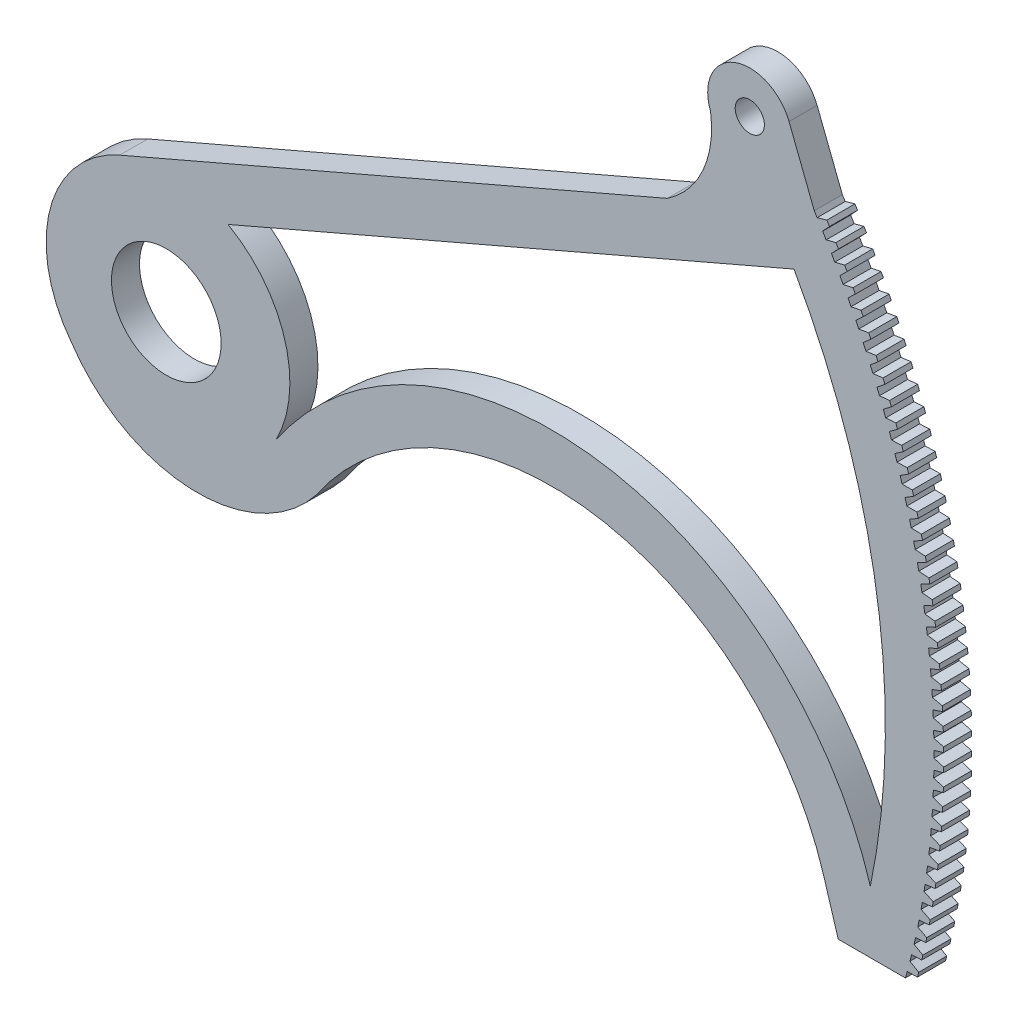
from build123d import *

# Parameters (mm, degrees)
SKETCH1_R           = 12.408212295
SKETCH1_R_2         = 3.302
BOSS_EXTRUDE1_DEPTH = 6.35


with BuildPart() as part:
    # Sketch1 → Boss-Extrude1 (new body)
    with BuildSketch(Plane(origin=(0, 0, 0), x_dir=(-1, 0, 0), z_dir=(0, 0, -1))):
        with BuildLine():
            Line((10.539485883, 25.458586117), (-113.354485872, 78.936296964))
            ThreePointArc((-113.354485872, 78.936296964), (-121.435921865, 88.480292523), (-123.16202884, 100.866495074))
            ThreePointArc((-123.16202884, 100.866495074), (-128.583573423, 113.191176173), (-140.91304048, 107.780524464))
            Line((-140.91304048, 107.780524464), (-146.633186787, 93.132961962))
            ThreePointArc((-146.633186787, 93.132961962), (-146.956062871, 92.622651964), (-147.27716299, 92.111222621))
            Line((-147.27716299, 92.111222621), (-149.484042103, 92.742363927))
            Line((-149.484042103, 92.742363927), (-150.076889657, 91.779911207))
            Line((-150.076889657, 91.779911207), (-148.521400775, 90.091251423))
            ThreePointArc((-148.521400775, 90.091251423), (-148.917928344, 89.434281397), (-149.311549889, 88.775566126))
            Line((-149.311549889, 88.775566126), (-151.53206555, 89.356913668))
            Line((-151.53206555, 89.356913668), (-152.10311697, 88.381370878))
            Line((-152.10311697, 88.381370878), (-150.510042508, 86.728122171))
            ThreePointArc((-150.510042508, 86.728122171), (-150.891694102, 86.062400165), (-151.270401156, 85.394998714))
            Line((-151.270401156, 85.394998714), (-153.503430022, 85.926258394))
            Line((-153.503430022, 85.926258394), (-154.052396417, 84.938119053))
            Line((-154.052396417, 84.938119053), (-152.422542301, 83.32111779))
            ThreePointArc((-152.422542301, 83.32111779), (-152.789124845, 82.646980588), (-153.152725822, 81.971230591))
            Line((-153.152725822, 81.971230591), (-155.39713822, 82.452133648))
            Line((-155.39713822, 82.452133648), (-155.923741872, 81.451897649))
            Line((-155.923741872, 81.451897649), (-154.257932633, 79.871961859))
            ThreePointArc((-154.257932633, 79.871961859), (-154.609260676, 79.189750502), (-154.957571632, 78.505993816))
            Line((-154.957571632, 78.505993816), (-157.212232131, 78.936296964))
            Line((-157.212232131, 78.936296964), (-157.716206636, 77.92447032))
            Line((-157.716206636, 77.92447032), (-156.015284993, 76.38239928))
            ThreePointArc((-156.015284993, 76.38239928), (-156.3511808, 75.692458895), (-156.68402553, 75.001041427))
            Line((-156.68402553, 75.001041427), (-158.947793513, 75.380526979))
            Line((-158.947793513, 75.380526979), (-159.428883912, 74.357621565))
            Line((-159.428883912, 74.357621565), (-157.69371035, 72.854195399))
            ThreePointArc((-157.69371035, 72.854195399), (-158.014003995, 72.156875021), (-158.331214113, 71.458146554))
            Line((-158.331214113, 71.458146554), (-160.602944356, 71.786622532))
            Line((-160.602944356, 71.786622532), (-161.06090727, 70.753155828))
            Line((-161.06090727, 70.753155828), (-159.292359601, 69.289135108))
            ThreePointArc((-159.292359601, 69.289135108), (-159.596889049, 68.584787506), (-159.898304081, 67.879101522))
            Line((-159.898304081, 67.879101522), (-162.176847332, 68.156401751))
            Line((-162.176847332, 68.156401751), (-162.611451081, 67.112896581))
            Line((-162.611451081, 67.112896581), (-160.810424001, 65.689021944))
            ThreePointArc((-160.810424001, 65.689021944), (-161.099035192, 64.978003443), (-161.384502654, 64.265716944))
            Line((-161.384502654, 64.265716944), (-163.668706215, 64.491701141))
            Line((-163.668706215, 64.491701141), (-164.079730936, 63.438685406))
            Line((-164.079730936, 63.438685406), (-162.247135571, 62.055677181))
            ThreePointArc((-162.247135571, 62.055677181), (-162.5196825, 61.338347479), (-162.789057976, 60.619820805))
            Line((-162.789057976, 60.619820805), (-165.077766285, 60.794374646))
            Line((-165.077766285, 60.794374646), (-165.465004044, 59.732381059))
            Line((-165.465004044, 59.732381059), (-163.60176749, 58.390938899))
            ThreePointArc((-163.60176749, 58.390938899), (-163.858112277, 57.667660889), (-164.111259493, 56.943257538))
            Line((-164.111259493, 56.943257538), (-166.403314708, 57.066292716))
            Line((-166.403314708, 57.066292716), (-166.766569603, 55.995858533))
            Line((-166.766569603, 55.995858533), (-164.873634459, 54.696661064))
            ThreePointArc((-164.873634459, 54.696661064), (-165.113647421, 53.967800647), (-165.350438311, 53.237887089))
            Line((-165.350438311, 53.237887089), (-167.644680899, 53.309341363))
            Line((-167.644680899, 53.309341363), (-167.983769163, 52.231008108))
            Line((-167.983769163, 52.231008108), (-166.06209305, 50.974712584))
            ThreePointArc((-166.06209305, 50.974712584), (-166.285652766, 50.240638486), (-166.50596754, 49.505583978))
            Line((-166.50596754, 49.505583978), (-168.801236859, 49.525421199))
            Line((-168.801236859, 49.525421199), (-169.11598695, 48.439734394))
            Line((-169.11598695, 48.439734394), (-167.166542031, 47.226976367))
            ThreePointArc((-167.166542031, 47.226976367), (-167.373535404, 46.488059949), (-167.577262605, 45.748236351))
            Line((-167.577262605, 45.748236351), (-169.872397496, 45.716446484))
            Line((-169.872397496, 45.716446484), (-170.162650183, 44.623955369))
            Line((-170.162650183, 44.623955369), (-168.186422668, 43.455348363))
            ThreePointArc((-168.186422668, 43.455348363), (-168.376744981, 42.711963439), (-168.563781546, 41.967745022))
            Line((-168.563781546, 41.967745022), (-170.857620917, 41.884344149))
            Line((-170.857620917, 41.884344149), (-171.123229364, 40.785601408))
            Line((-171.123229364, 40.785601408), (-169.121219012, 39.661736614))
            ThreePointArc((-169.121219012, 39.661736614), (-169.294773983, 38.914259256), (-169.46502529, 38.166022515))
            Line((-169.46502529, 38.166022515), (-171.756408704, 38.031052828))
            Line((-171.756408704, 38.031052828), (-171.997238542, 36.926614306))
            Line((-171.997238542, 36.926614306), (-169.970458155, 35.848060279))
            ThreePointArc((-169.970458155, 35.848060279), (-170.127157984, 35.096868631), (-170.280537906, 34.344992093))
            Line((-170.280537906, 34.344992093), (-172.568306168, 34.158521873))
            Line((-172.568306168, 34.158521873), (-172.784235562, 33.048946298))
            Line((-172.784235562, 33.048946298), (-170.733710474, 32.01624867))
            ThreePointArc((-170.733710474, 32.01624867), (-170.873475887, 31.261722754), (-171.009906829, 30.506586788))
            Line((-171.009906829, 30.506586788), (-173.292902575, 30.268710368))
            Line((-173.292902575, 30.268710368), (-173.483822288, 29.154559067))
            Line((-173.483822288, 29.154559067), (-171.410589846, 28.168240273))
            ThreePointArc((-171.410589846, 28.168240273), (-171.533350136, 27.410761798), (-171.652763079, 26.652748422))
            Line((-171.652763079, 26.652748422), (-173.929831357, 26.363586142))
            Line((-173.929831357, 26.363586142), (-174.095644805, 25.245422756))
            Line((-174.095644805, 25.245422756), (-172.00075384, 24.305981767))
            ThreePointArc((-172.00075384, 24.305981767), (-172.106446905, 23.545933936), (-172.208781439, 22.785426624))
            Line((-172.208781439, 22.785426624), (-174.478770297, 22.445124769))
            Line((-174.478770297, 22.445124769), (-174.619393595, 21.323514968))
            Line((-174.619393595, 21.323514968), (-172.503903899, 20.431427041))
            ThreePointArc((-172.503903899, 20.431427041), (-172.592476269, 19.669194357), (-172.677680624, 18.906577843))
            Line((-172.677680624, 18.906577843), (-174.93944169, 18.51530857))
            Line((-174.93944169, 18.51530857), (-175.054803699, 17.390819768))
            Line((-175.054803699, 17.390819768), (-172.919785481, 16.546536203))
            ThreePointArc((-172.919785481, 16.546536203), (-172.991192348, 15.782504275), (-173.059223419, 15.018164362))
            Line((-173.059223419, 15.018164362), (-175.311612486, 14.57612561))
            Line((-175.311612486, 14.57612561), (-175.401654844, 13.449326678))
            Line((-175.401654844, 13.449326678), (-173.248188196, 12.653274593))
            ThreePointArc((-173.248188196, 12.653274593), (-173.302393436, 11.887829937), (-173.353216807, 11.1221533))
            Line((-173.353216807, 11.1221533), (-175.595094406, 10.629568694))
            Line((-175.595094406, 10.629568694), (-175.659771562, 9.501029672))
            Line((-175.659771562, 9.501029672), (-173.488945907, 8.753611783))
            ThreePointArc((-173.488945907, 8.753611783), (-173.525922098, 7.987141633), (-173.559512057, 7.220515621))
            Line((-173.559512057, 7.220515621), (-175.78974404, 6.677634356))
            Line((-175.78974404, 6.677634356), (-175.829023274, 5.547926163))
            Line((-175.829023274, 5.547926163), (-173.641936816, 4.849520584))
            ThreePointArc((-173.641936816, 4.849520584), (-173.661665251, 4.082412692), (-173.678004807, 3.315225135))
            Line((-173.678004807, 3.315225135), (-175.895462915, 2.722321851))
            Line((-175.895462915, 2.722321851), (-175.909324356, 1.592015998))
            Line((-175.909324356, 1.592015998), (-173.707083527, 0.942976048))
            ThreePointArc((-173.707083527, 0.942976048), (-173.709554226, 0.175618488), (-173.708635111, -0.591742499))
            Line((-173.708635111, -0.591742499), (-175.912197548, -1.234367857))
            Line((-175.912197548, -1.234367857), (-175.900634184, -2.364699555))
            Line((-175.900634184, -2.364699555), (-173.684353082, -2.964045534))
            ThreePointArc((-173.684353082, -2.964045534), (-173.669564795, -3.731264561), (-173.651387474, -4.498410775))
            Line((-173.651387474, -4.498410775), (-175.839939474, -5.190433107))
            Line((-175.839939474, -5.190433107), (-175.802957154, -6.320218825))
            Line((-175.802957154, -6.320218825), (-173.573756979, -6.869567626))
            ThreePointArc((-173.573756979, -6.869567626), (-173.541717188, -7.636259989), (-173.506290858, -8.402803337))
            Line((-173.506290858, -8.402803337), (-175.678725248, -9.143872555))
            Line((-175.678725248, -9.143872555), (-175.616342682, -10.272540741))
            Line((-175.616342682, -10.272540741), (-173.37535117, -10.771614453))
            ThreePointArc((-173.37535117, -10.771614453), (-173.326076083, -11.537392289), (-173.273418666, -12.302944982))
            Line((-173.273418666, -12.302944982), (-175.428636427, -13.092686184))
            Line((-175.428636427, -13.092686184), (-175.340885173, -14.219665854))
            Line((-175.340885173, -14.219665854), (-173.089236026, -14.668211999))
            ThreePointArc((-173.089236026, -14.668211999), (-173.022750571, -15.432687906), (-172.952888705, -16.196862656))
            Line((-172.952888705, -16.196862656), (-175.089799529, -17.034876317))
            Line((-175.089799529, -17.034876317), (-174.97672398, -18.15959734))
            Line((-174.97672398, -18.15959734), (-172.71555629, -18.557389002))
            ThreePointArc((-172.71555629, -18.557389002), (-172.631894102, -19.320176238), (-172.54486313, -20.082586455))
            Line((-172.54486313, -20.082586455), (-174.662385969, -20.96844863))
            Line((-174.662385969, -20.96844863), (-174.524043328, -22.090342018))
            Line((-174.524043328, -22.090342018), (-172.254501005, -22.437177957))
            ThreePointArc((-172.254501005, -22.437177957), (-172.153704408, -23.197890633), (-172.049548358, -23.958150618))
            Line((-172.049548358, -23.958150618), (-174.146611972, -24.891413157))
            Line((-174.146611972, -24.891413157), (-173.983072227, -26.009911351))
            Line((-173.983072227, -26.009911351), (-171.706303415, -26.305616106))
            ThreePointArc((-171.706303415, -26.305616106), (-171.588423401, -27.063869382), (-171.467194965, -27.821594527))
            Line((-171.467194965, -27.821594527), (-173.542738465, -28.801785297))
            Line((-173.542738465, -28.801785297), (-173.35408435, -29.916322459))
            Line((-173.35408435, -29.916322459), (-171.07124085, -30.160746434))
            ThreePointArc((-171.07124085, -30.160746434), (-170.936337053, -30.916156716), (-170.79809756, -31.670963692))
            Line((-170.79809756, -31.670963692), (-172.851070943, -32.697586824))
            Line((-172.851070943, -32.697586824), (-172.637397896, -33.807599116))
            Line((-172.637397896, -33.807599116), (-170.349634582, -34.000618659))
            ThreePointArc((-170.349634582, -34.000618659), (-170.19777525, -34.75280379), (-170.042594634, -35.504310746))
            Line((-170.042594634, -35.504310746), (-172.071959316, -36.576846877))
            Line((-172.071959316, -36.576846877), (-171.833375432, -37.681772753))
            Line((-171.833375432, -37.681772753), (-169.541849667, -37.823290216))
            ThreePointArc((-169.541849667, -37.823290216), (-169.373111624, -38.571869672), (-169.20106839, -39.319696427))
            Line((-169.20106839, -39.319696427), (-171.20579773, -40.437602969))
            Line((-171.20579773, -40.437602969), (-170.942423708, -41.536883454))
            Line((-170.942423708, -41.536883454), (-168.648294758, -41.626827246))
            ThreePointArc((-168.648294758, -41.626827246), (-168.462763368, -42.371422325), (-168.27394455, -43.115190557))
            Line((-168.27394455, -43.115190557), (-170.25302437, -44.27790197))
            Line((-170.25302437, -44.27790197), (-169.964993449, -45.370980946))
            Line((-169.964993449, -45.370980946), (-167.669421897, -45.409305565))
            ThreePointArc((-167.669421897, -45.409305565), (-167.466164791, -46.153263388), (-167.259606723, -46.896311475))
            Line((-167.259606723, -46.896311475), (-152.054130393, -46.896311475))
            Line((-152.054130393, -46.896311475), (-148.767258454, -36.099192633))
            ThreePointArc((-148.767258454, -36.099192633), (-96.785878161, 8.760995722), (-33.940593142, -18.897105216))
            ThreePointArc((-33.940593142, -18.897105216), (-5.658002222, -31.885433701), (21.487058667, -16.662185184))
            ThreePointArc((21.487058667, -16.662185184), (26.30414767, 7.072892878), (10.539485883, 25.458586117))
        make_face()
        Circle(SKETCH1_R, mode=Mode.SUBTRACT)
        with Locations((-132.040589467, 104.315666888)):
            Circle(SKETCH1_R_2, mode=Mode.SUBTRACT)
        with BuildLine():
            Line((-142.041347589, 79.412448473), (-13.981610582, 24.136622782))
            ThreePointArc((-13.981610582, 24.136622782), (-26.860070669, 7.893841022), (-24.78957164, -12.731282669))
            ThreePointArc((-24.78957164, -12.731282669), (-98.420693279, 19.673646259), (-159.323390025, -32.88568233))
            ThreePointArc((-159.323390025, -32.88568233), (-160.828595467, 24.824829539), (-142.041347589, 79.412448473))
        make_face(mode=Mode.SUBTRACT)
    extrude(amount=-BOSS_EXTRUDE1_DEPTH)


solid = part.part
